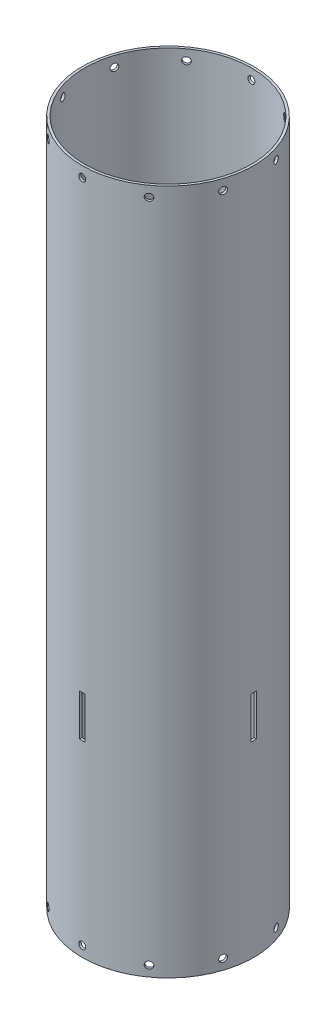
from build123d import *

# Parameters (mm, degrees)
SKETCH1_R           = 78.359
SKETCH1_R_2         = 76.2
BOSS_EXTRUDE1_DEPTH = 626.11
SKETCH2_R           = 3.175
CUT_EXTRUDE1_DEPTH  = 636.841173456
CIRPATTERN1_COUNT   = 10
SKETCH3_W           = 5.08
SKETCH3_H           = 38.1
CUT_EXTRUDE2_DEPTH  = 636.841173579
CIRPATTERN2_COUNT   = 4


with BuildPart() as part:
    # Sketch1 → Boss-Extrude1 (new body)
    with BuildSketch(Plane(origin=(0, 0, 0), x_dir=(1, 0, 0), z_dir=(0, 1, 0))):
        Circle(SKETCH1_R)
        Circle(SKETCH1_R_2, mode=Mode.SUBTRACT)
    extrude(amount=BOSS_EXTRUDE1_DEPTH)

    # Sketch2 → Cut-Extrude1 (cut, through all)
    with BuildSketch(Plane.XY):
        with Locations((0, 9.525)):
            Circle(SKETCH2_R)
        with Locations((0, 616.585)):
            Circle(SKETCH2_R)
    cut_extrude1 = extrude(amount=-CUT_EXTRUDE1_DEPTH, mode=Mode.SUBTRACT)

    # CirPattern1: Cut-Extrude1 ×10 about axis
    cirpattern1_axis = Axis((0, 0, 0), (0, 1, 0))
    for i in range(1, CIRPATTERN1_COUNT):
        add(cut_extrude1.rotate(cirpattern1_axis, i * 360 / CIRPATTERN1_COUNT), mode=Mode.SUBTRACT)

    # Sketch3 → Cut-Extrude2 (cut, through all)
    with BuildSketch(Plane.XY):
        with Locations((0, 190.5)):
            Rectangle(SKETCH3_W, SKETCH3_H)
    cut_extrude2 = extrude(amount=-CUT_EXTRUDE2_DEPTH, mode=Mode.SUBTRACT)

    # CirPattern2: Cut-Extrude2 ×4 about axis
    cirpattern2_axis = Axis((0, 626.11, 0), (0, -1, 0))
    for i in range(1, CIRPATTERN2_COUNT):
        add(cut_extrude2.rotate(cirpattern2_axis, i * 360 / CIRPATTERN2_COUNT), mode=Mode.SUBTRACT)


solid = part.part
